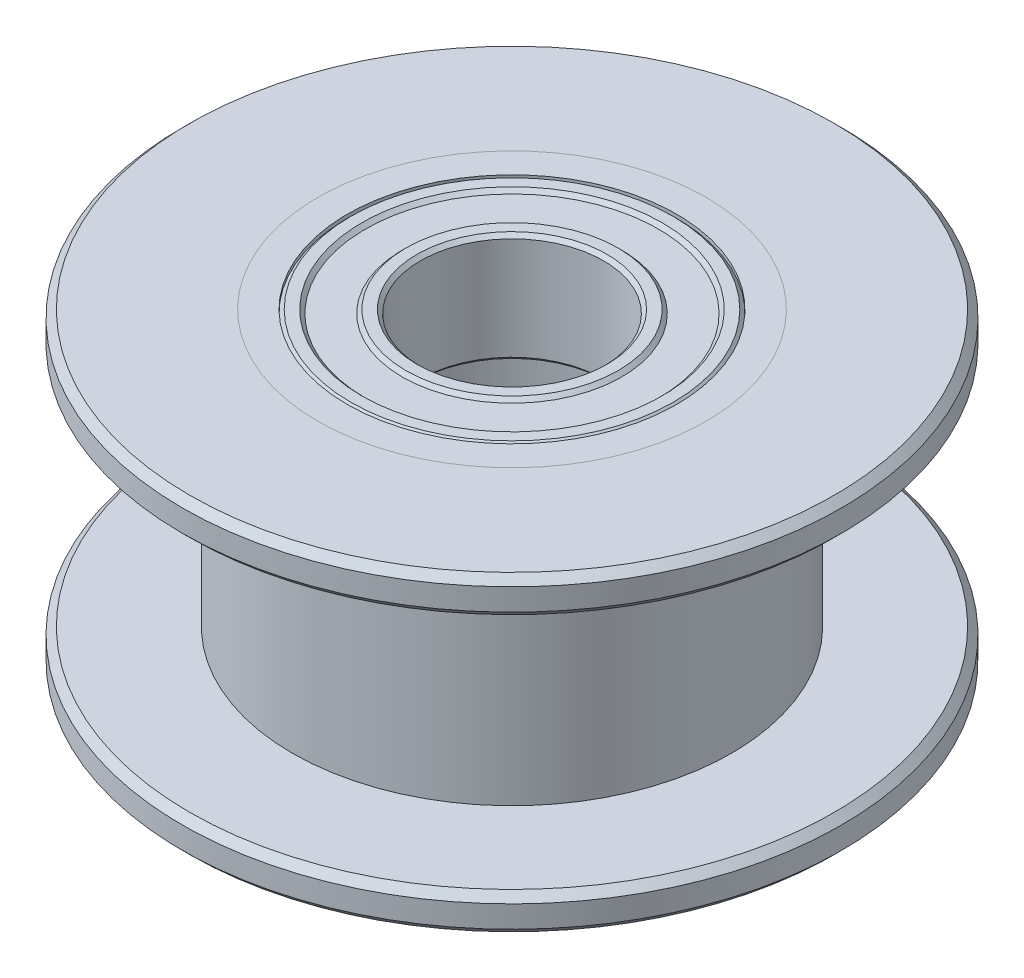
from build123d import *

# Parameters (mm, degrees)
SKICA2_R                  = 9
SKICA2_R_2                = 5.3
P_IDAT_VYSUNUT_M1_DEPTH   = 1
ZKOSEN_1_SIZE             = 0.2
SKICA3_R                  = 9
SKICA3_R_2                = 5.3
P_IDAT_VYSUNUT_M2_DEPTH   = 1
ZKOSEN_2_SIZE             = 0.2
SKICA4_R                  = 3
SKICA4_R_2                = 2.5
P_IDAT_VYSUNUT_M3_DEPTH   = 3
SKICA4_R_3                = 4.5
SKICA4_R_4                = 4
P_IDAT_VYSUNUT_M3_2_DEPTH = 3
P_IDAT_START              = 0.1
SKICA4_4_R                = 4
SKICA4_4_R_2              = 3
P_IDAT_VYSUNUT_M4_DEPTH   = 2.8
ZKOSEN_3_SIZE             = 0.1
ZKOSEN_4_SIZE             = 0.1
SKICA5_R                  = 3
SKICA5_R_2                = 2.5
P_IDAT_VYSUNUT_M6_DEPTH   = 3
SKICA5_R_3                = 4.5
SKICA5_R_4                = 4
P_IDAT_VYSUNUT_M6_2_DEPTH = 3
ZKOSEN_5_SIZE             = 0.1
ZKOSEN_6_SIZE             = 0.1
SKICA5_4_R                = 4
SKICA5_4_R_2              = 3
P_IDAT_VYSUNUT_M7_DEPTH   = 2.8


with BuildPart() as part:
    # Skica1 → Rotovat1 (revolve)
    with BuildSketch(Plane.XY):
        Polygon((-4.5, 8.5), (-5.3, 8.5), (-5.3, 7.5), (-6, 7.5), (-6, 1), (-5.3, 1), (-5.3, 0), (-4.5, 0), (-4.5, 3), (-4, 3), (-4, 5.5), (-4.5, 5.5), align=None)
    revolve(axis=Axis((0, 8.5, 0), (0, -1, 0)))


with BuildPart() as body_2:
    # Skica2 → Přidat vysunutím1 (new body)
    with BuildSketch(Plane(origin=(0, 7.5, 0), x_dir=(1, 0, 0), z_dir=(0, 1, 0))):
        Circle(SKICA2_R)
        Circle(SKICA2_R_2, mode=Mode.SUBTRACT)
    extrude(amount=P_IDAT_VYSUNUT_M1_DEPTH)

    # Zkosení1
    zkosen_1_edges = [body_2.edges().sort_by_distance(p)[0] for p in [
        (-9, 7.5, 0),
        (-9, 8.5, 0),
    ]]
    chamfer(zkosen_1_edges, length=ZKOSEN_1_SIZE)


with BuildPart() as body_3:
    # Skica3 → Přidat vysunutím2 (new body)
    with BuildSketch(Plane.XZ.offset(-1)):
        Circle(SKICA3_R)
        Circle(SKICA3_R_2, mode=Mode.SUBTRACT)
    extrude(amount=P_IDAT_VYSUNUT_M2_DEPTH)

    # Zkosení2
    zkosen_2_edges = [body_3.edges().sort_by_distance(p)[0] for p in [
        (-9, 0, 0),
        (-9, 1, 0),
    ]]
    chamfer(zkosen_2_edges, length=ZKOSEN_2_SIZE)


with BuildPart() as body_4:
    # Skica4 → Přidat vysunutím3 (new body)
    with BuildSketch(Plane(origin=(0, 5.5, 0), x_dir=(1, 0, 0), z_dir=(0, 1, 0))):
        Circle(SKICA4_R)
        Circle(SKICA4_R_2, mode=Mode.SUBTRACT)
    extrude(amount=P_IDAT_VYSUNUT_M3_DEPTH)

    # Zkosení3
    zkosen_3_edges = [body_4.edges().sort_by_distance(p)[0] for p in [
        (-3, 8.5, 0),
        (-2.5, 8.5, 0),
        (-3, 5.5, 0),
        (-2.5, 5.5, 0),
    ]]
    chamfer(zkosen_3_edges, length=ZKOSEN_3_SIZE)


with BuildPart() as body_5:
    # Skica4 → P_idat vysunut_m3 2 (new body)
    with BuildSketch(Plane(origin=(0, 5.5, 0), x_dir=(1, 0, 0), z_dir=(0, 1, 0))):
        Circle(SKICA4_R_3)
        Circle(SKICA4_R_4, mode=Mode.SUBTRACT)
    extrude(amount=P_IDAT_VYSUNUT_M3_2_DEPTH)

    # Zkosení4
    zkosen_4_edges = [body_5.edges().sort_by_distance(p)[0] for p in [
        (-4.5, 8.5, 0),
        (-4, 8.5, 0),
        (-4.5, 5.5, 0),
        (-4, 5.5, 0),
    ]]
    chamfer(zkosen_4_edges, length=ZKOSEN_4_SIZE)


with BuildPart() as body_6:
    # Skica4<4> → Přidat vysunutím4 (new body)
    with BuildSketch(Plane(origin=(0, 5.5, 0), x_dir=(1, 0, 0), z_dir=(0, 1, 0)).offset(P_IDAT_START)):
        Circle(SKICA4_4_R)
        Circle(SKICA4_4_R_2, mode=Mode.SUBTRACT)
    extrude(amount=P_IDAT_VYSUNUT_M4_DEPTH)


with BuildPart() as body_7:
    # Skica5 → Přidat vysunutím6 (new body)
    with BuildSketch(Plane.XZ.offset(-3)):
        Circle(SKICA5_R)
        Circle(SKICA5_R_2, mode=Mode.SUBTRACT)
    extrude(amount=P_IDAT_VYSUNUT_M6_DEPTH)

    # Zkosení5
    zkosen_5_edges = [body_7.edges().sort_by_distance(p)[0] for p in [
        (-3, 0, 0),
        (-2.5, 0, 0),
        (-3, 3, 0),
        (-2.5, 3, 0),
    ]]
    chamfer(zkosen_5_edges, length=ZKOSEN_5_SIZE)


with BuildPart() as body_8:
    # Skica5 → P_idat vysunut_m6 2 (new body)
    with BuildSketch(Plane.XZ.offset(-3)):
        Circle(SKICA5_R_3)
        Circle(SKICA5_R_4, mode=Mode.SUBTRACT)
    extrude(amount=P_IDAT_VYSUNUT_M6_2_DEPTH)

    # Zkosení6
    zkosen_6_edges = [body_8.edges().sort_by_distance(p)[0] for p in [
        (-4.5, 3, 0),
        (-4.5, 0, 0),
        (-4, 0, 0),
        (-4, 3, 0),
    ]]
    chamfer(zkosen_6_edges, length=ZKOSEN_6_SIZE)


with BuildPart() as body_9:
    # Skica5<4> → Přidat vysunutím7 (new body)
    with BuildSketch(Plane.XZ.offset(-3).offset(P_IDAT_START)):
        Circle(SKICA5_4_R)
        Circle(SKICA5_4_R_2, mode=Mode.SUBTRACT)
    extrude(amount=P_IDAT_VYSUNUT_M7_DEPTH)


solid = Compound([part.part, body_2.part, body_3.part, body_4.part, body_5.part, body_6.part, body_7.part, body_8.part, body_9.part])
